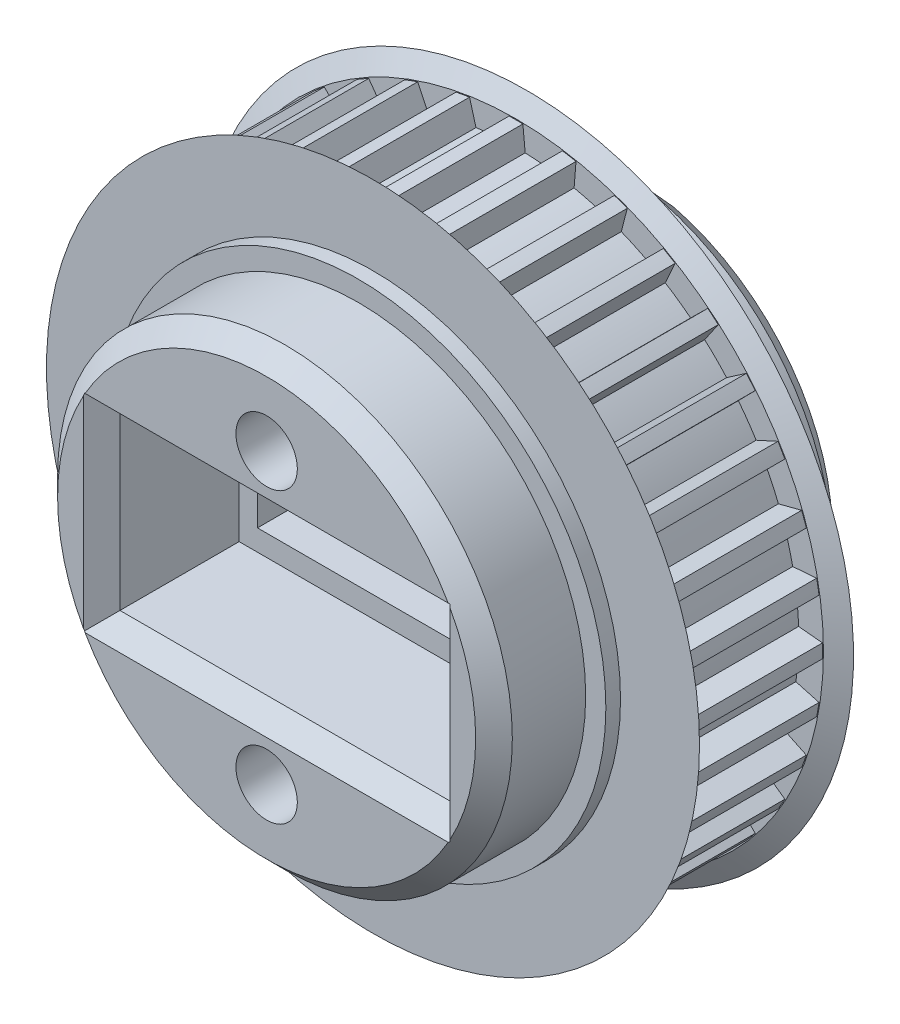
from build123d import *
from build123d.topology import SkipClean

# Parameters (mm, degrees)
CROQUIS1_R                 = 2
SALIENTE_EXTRUIR1_DEPTH    = 7.2
CROQUIS2_R                 = 18.5
CROQUIS2_R_2               = 2
SALIENTE_EXTRUIR2_DEPTH    = 0.6
SALIENTE_EXTRUIR4_START    = 5.8
CROQUIS4_R                 = 12.45
CROQUIS4_R_2               = 2
SALIENTE_EXTRUIR4_DEPTH    = 5.8
SALIENTE_EXTRUIR6_START    = 0.6
CROQUIS6_R                 = 18.5
CROQUIS6_R_2               = 2
SALIENTE_EXTRUIR6_DEPTH    = 0.6
SALIENTE_EXTRUIR5_START    = 0.6
CROQUIS5_R                 = 13.5
CROQUIS5_R_2               = 2
SALIENTE_EXTRUIR5_DEPTH    = 0.6
CHAFL_N2_SIZE              = 1.732050808
CHAFL_N2_SIZE_2            = 1
CROQUIS3_R                 = 12.4
CROQUIS3_R_2               = 2
SALIENTE_EXTRUIR7_DEPTH    = 5.8
CHAFL_N4_SIZE              = 1
CROQUIS7_R                 = 13.5
CROQUIS7_R_2               = 2
SALIENTE_EXTRUIR8_DEPTH    = 0.8
CORTAR_EXTRUIR1_DEPTH      = 29.620819277
CORTAR_EXTRUIR1_DEPTH_BACK = 29.620819277
CROQUIS8_R                 = 1.675
CROQUIS8_W                 = 16
CROQUIS8_H                 = 7
CORTAR_EXTRUIR2_DEPTH      = 5.5
REDONDEO1_R                = 2.5
CROQUIS10_W                = 18
CROQUIS10_H                = 9.3
CORTAR_EXTRUIR3_DEPTH      = 7.5
CHAFL_N5_SIZE              = 1


with BuildPart() as part:
    # Croquis1 → Saliente-Extruir1 (new body)
    with BuildSketch(Plane.XY):
        with BuildLine():
            Line((-0.375, 16.714216942), (-0.5, 15.410313844))
            ThreePointArc((-0.5, 15.410313844), (-1.343804123, 15.359751406), (-2.18356904, 15.263020639))
            Line((-2.18356904, 15.263020639), (-2.533090406, 16.525408497))
            ThreePointArc((-2.533090406, 16.525408497), (-2.903123715, 16.464432747), (-3.271696221, 16.395172363))
            Line((-3.271696221, 16.395172363), (-3.168376793, 15.089372461))
            ThreePointArc((-3.168376793, 15.089372461), (-3.99058156, 14.893053132), (-4.800791439, 14.651968275))
            Line((-4.800791439, 14.651968275), (-5.364214141, 15.834483876))
            ThreePointArc((-5.364214141, 15.834483876), (-5.718037486, 15.710178876), (-6.068983607, 15.577968769))
            Line((-6.068983607, 15.577968769), (-5.74048406, 14.309948132))
            ThreePointArc((-5.74048406, 14.309948132), (-6.516107195, 13.973836975), (-7.27214422, 13.595723269))
            Line((-7.27214422, 13.595723269), (-8.032348945, 14.662436476))
            ThreePointArc((-8.032348945, 14.662436476), (-8.35921158, 14.478579169), (-8.681867997, 14.287436476))
            Line((-8.681867997, 14.287436476), (-8.138169624, 13.095723269))
            ThreePointArc((-8.138169624, 13.095723269), (-8.843644211, 12.630032852), (-9.522536579, 12.126379092))
            Line((-9.522536579, 12.126379092), (-10.45642489, 13.044878363))
            ThreePointArc((-10.45642489, 13.044878363), (-10.746395261, 12.80705516), (-11.030958222, 12.562787656))
            Line((-11.030958222, 12.562787656), (-10.288581022, 11.483591482))
            ThreePointArc((-10.288581022, 11.483591482), (-10.902471572, 10.902471572), (-11.483591482, 10.288581022))
            Line((-11.483591482, 10.288581022), (-12.562787656, 11.030958222))
            ThreePointArc((-12.562787656, 11.030958222), (-12.80705516, 10.746395261), (-13.044878363, 10.45642489))
            Line((-13.044878363, 10.45642489), (-12.126379092, 9.522536579))
            ThreePointArc((-12.126379092, 9.522536579), (-12.630032852, 8.843644211), (-13.095723269, 8.138169624))
            Line((-13.095723269, 8.138169624), (-14.287436476, 8.681867997))
            ThreePointArc((-14.287436476, 8.681867997), (-14.478579169, 8.35921158), (-14.662436476, 8.032348945))
            Line((-14.662436476, 8.032348945), (-13.595723269, 7.27214422))
            ThreePointArc((-13.595723269, 7.27214422), (-13.973836975, 6.516107195), (-14.309948132, 5.74048406))
            Line((-14.309948132, 5.74048406), (-15.577968769, 6.068983607))
            ThreePointArc((-15.577968769, 6.068983607), (-15.710178876, 5.718037486), (-15.834483876, 5.364214141))
            Line((-15.834483876, 5.364214141), (-14.651968275, 4.800791439))
            ThreePointArc((-14.651968275, 4.800791439), (-14.893053132, 3.99058156), (-15.089372461, 3.168376793))
            Line((-15.089372461, 3.168376793), (-16.395172363, 3.271696221))
            ThreePointArc((-16.395172363, 3.271696221), (-16.464432747, 2.903123715), (-16.525408497, 2.533090406))
            Line((-16.525408497, 2.533090406), (-15.263020639, 2.18356904))
            ThreePointArc((-15.263020639, 2.18356904), (-15.359751406, 1.343804123), (-15.410313844, 0.5))
            Line((-15.410313844, 0.5), (-16.714216942, 0.375))
            ThreePointArc((-16.714216942, 0.375), (-16.718423161, 0), (-16.714216942, -0.375))
            Line((-16.714216942, -0.375), (-15.410313844, -0.5))
            ThreePointArc((-15.410313844, -0.5), (-15.359751406, -1.343804123), (-15.263020639, -2.18356904))
            Line((-15.263020639, -2.18356904), (-16.525408497, -2.533090406))
            ThreePointArc((-16.525408497, -2.533090406), (-16.464432747, -2.903123715), (-16.395172363, -3.271696221))
            Line((-16.395172363, -3.271696221), (-15.089372461, -3.168376793))
            ThreePointArc((-15.089372461, -3.168376793), (-14.893053132, -3.99058156), (-14.651968275, -4.800791439))
            Line((-14.651968275, -4.800791439), (-15.834483876, -5.364214141))
            ThreePointArc((-15.834483876, -5.364214141), (-15.710178876, -5.718037486), (-15.577968769, -6.068983607))
            Line((-15.577968769, -6.068983607), (-14.309948132, -5.74048406))
            ThreePointArc((-14.309948132, -5.74048406), (-13.973836975, -6.516107195), (-13.595723269, -7.27214422))
            Line((-13.595723269, -7.27214422), (-14.662436476, -8.032348945))
            ThreePointArc((-14.662436476, -8.032348945), (-14.478579169, -8.35921158), (-14.287436476, -8.681867997))
            Line((-14.287436476, -8.681867997), (-13.095723269, -8.138169624))
            ThreePointArc((-13.095723269, -8.138169624), (-12.630032852, -8.843644211), (-12.126379092, -9.522536579))
            Line((-12.126379092, -9.522536579), (-13.044878363, -10.45642489))
            ThreePointArc((-13.044878363, -10.45642489), (-12.80705516, -10.746395261), (-12.562787656, -11.030958222))
            Line((-12.562787656, -11.030958222), (-11.483591482, -10.288581022))
            ThreePointArc((-11.483591482, -10.288581022), (-10.902471572, -10.902471572), (-10.288581022, -11.483591482))
            Line((-10.288581022, -11.483591482), (-11.030958222, -12.562787656))
            ThreePointArc((-11.030958222, -12.562787656), (-10.746395261, -12.80705516), (-10.45642489, -13.044878363))
            Line((-10.45642489, -13.044878363), (-9.522536579, -12.126379092))
            ThreePointArc((-9.522536579, -12.126379092), (-8.843644211, -12.630032852), (-8.138169624, -13.095723269))
            Line((-8.138169624, -13.095723269), (-8.681867997, -14.287436476))
            ThreePointArc((-8.681867997, -14.287436476), (-8.35921158, -14.478579169), (-8.032348945, -14.662436476))
            Line((-8.032348945, -14.662436476), (-7.27214422, -13.595723269))
            ThreePointArc((-7.27214422, -13.595723269), (-6.516107195, -13.973836975), (-5.74048406, -14.309948132))
            Line((-5.74048406, -14.309948132), (-6.068983607, -15.577968769))
            ThreePointArc((-6.068983607, -15.577968769), (-5.718037486, -15.710178876), (-5.364214141, -15.834483876))
            Line((-5.364214141, -15.834483876), (-4.800791439, -14.651968275))
            ThreePointArc((-4.800791439, -14.651968275), (-3.99058156, -14.893053132), (-3.168376793, -15.089372461))
            Line((-3.168376793, -15.089372461), (-3.271696221, -16.395172363))
            ThreePointArc((-3.271696221, -16.395172363), (-2.903123715, -16.464432747), (-2.533090406, -16.525408497))
            Line((-2.533090406, -16.525408497), (-2.18356904, -15.263020639))
            ThreePointArc((-2.18356904, -15.263020639), (-1.343804123, -15.359751406), (-0.5, -15.410313844))
            Line((-0.5, -15.410313844), (-0.375, -16.714216942))
            ThreePointArc((-0.375, -16.714216942), (0, -16.718423161), (0.375, -16.714216942))
            Line((0.375, -16.714216942), (0.5, -15.410313844))
            ThreePointArc((0.5, -15.410313844), (1.343804123, -15.359751406), (2.18356904, -15.263020639))
            Line((2.18356904, -15.263020639), (2.533090406, -16.525408497))
            ThreePointArc((2.533090406, -16.525408497), (2.903123715, -16.464432747), (3.271696221, -16.395172363))
            Line((3.271696221, -16.395172363), (3.168376793, -15.089372461))
            ThreePointArc((3.168376793, -15.089372461), (3.99058156, -14.893053132), (4.800791439, -14.651968275))
            Line((4.800791439, -14.651968275), (5.364214141, -15.834483876))
            ThreePointArc((5.364214141, -15.834483876), (5.718037486, -15.710178876), (6.068983607, -15.577968769))
            Line((6.068983607, -15.577968769), (5.74048406, -14.309948132))
            ThreePointArc((5.74048406, -14.309948132), (6.516107195, -13.973836975), (7.27214422, -13.595723269))
            Line((7.27214422, -13.595723269), (8.032348945, -14.662436476))
            ThreePointArc((8.032348945, -14.662436476), (8.35921158, -14.478579169), (8.681867997, -14.287436476))
            Line((8.681867997, -14.287436476), (8.138169624, -13.095723269))
            ThreePointArc((8.138169624, -13.095723269), (8.843644211, -12.630032852), (9.522536579, -12.126379092))
            Line((9.522536579, -12.126379092), (10.45642489, -13.044878363))
            ThreePointArc((10.45642489, -13.044878363), (10.746395261, -12.80705516), (11.030958222, -12.562787656))
            Line((11.030958222, -12.562787656), (10.288581022, -11.483591482))
            ThreePointArc((10.288581022, -11.483591482), (10.902471572, -10.902471572), (11.483591482, -10.288581022))
            Line((11.483591482, -10.288581022), (12.562787656, -11.030958222))
            ThreePointArc((12.562787656, -11.030958222), (12.80705516, -10.746395261), (13.044878363, -10.45642489))
            Line((13.044878363, -10.45642489), (12.126379092, -9.522536579))
            ThreePointArc((12.126379092, -9.522536579), (12.630032852, -8.843644211), (13.095723269, -8.138169624))
            Line((13.095723269, -8.138169624), (14.287436476, -8.681867997))
            ThreePointArc((14.287436476, -8.681867997), (14.478579169, -8.35921158), (14.662436476, -8.032348945))
            Line((14.662436476, -8.032348945), (13.595723269, -7.27214422))
            ThreePointArc((13.595723269, -7.27214422), (13.973836975, -6.516107195), (14.309948132, -5.74048406))
            Line((14.309948132, -5.74048406), (15.577968769, -6.068983607))
            ThreePointArc((15.577968769, -6.068983607), (15.710178876, -5.718037486), (15.834483876, -5.364214141))
            Line((15.834483876, -5.364214141), (14.651968275, -4.800791439))
            ThreePointArc((14.651968275, -4.800791439), (14.893053132, -3.99058156), (15.089372461, -3.168376793))
            Line((15.089372461, -3.168376793), (16.395172363, -3.271696221))
            ThreePointArc((16.395172363, -3.271696221), (16.464432747, -2.903123715), (16.525408497, -2.533090406))
            Line((16.525408497, -2.533090406), (15.263020639, -2.18356904))
            ThreePointArc((15.263020639, -2.18356904), (15.359751406, -1.343804123), (15.410313844, -0.5))
            Line((15.410313844, -0.5), (16.714216942, -0.375))
            ThreePointArc((16.714216942, -0.375), (16.718423161, 0), (16.714216942, 0.375))
            Line((16.714216942, 0.375), (15.410313844, 0.5))
            ThreePointArc((15.410313844, 0.5), (15.359751406, 1.343804123), (15.263020639, 2.18356904))
            Line((15.263020639, 2.18356904), (16.525408497, 2.533090406))
            ThreePointArc((16.525408497, 2.533090406), (16.464432747, 2.903123715), (16.395172363, 3.271696221))
            Line((16.395172363, 3.271696221), (15.089372461, 3.168376793))
            ThreePointArc((15.089372461, 3.168376793), (14.893053132, 3.99058156), (14.651968275, 4.800791439))
            Line((14.651968275, 4.800791439), (15.834483876, 5.364214141))
            ThreePointArc((15.834483876, 5.364214141), (15.710178876, 5.718037486), (15.577968769, 6.068983607))
            Line((15.577968769, 6.068983607), (14.309948132, 5.74048406))
            ThreePointArc((14.309948132, 5.74048406), (13.973836975, 6.516107195), (13.595723269, 7.27214422))
            Line((13.595723269, 7.27214422), (14.662436476, 8.032348945))
            ThreePointArc((14.662436476, 8.032348945), (14.478579169, 8.35921158), (14.287436476, 8.681867997))
            Line((14.287436476, 8.681867997), (13.095723269, 8.138169624))
            ThreePointArc((13.095723269, 8.138169624), (12.630032852, 8.843644211), (12.126379092, 9.522536579))
            Line((12.126379092, 9.522536579), (13.044878363, 10.45642489))
            ThreePointArc((13.044878363, 10.45642489), (12.80705516, 10.746395261), (12.562787656, 11.030958222))
            Line((12.562787656, 11.030958222), (11.483591482, 10.288581022))
            ThreePointArc((11.483591482, 10.288581022), (10.902471572, 10.902471572), (10.288581022, 11.483591482))
            Line((10.288581022, 11.483591482), (11.030958222, 12.562787656))
            ThreePointArc((11.030958222, 12.562787656), (10.746395261, 12.80705516), (10.45642489, 13.044878363))
            Line((10.45642489, 13.044878363), (9.522536579, 12.126379092))
            ThreePointArc((9.522536579, 12.126379092), (8.843644211, 12.630032852), (8.138169624, 13.095723269))
            Line((8.138169624, 13.095723269), (8.681867997, 14.287436476))
            ThreePointArc((8.681867997, 14.287436476), (8.35921158, 14.478579169), (8.032348945, 14.662436476))
            Line((8.032348945, 14.662436476), (7.27214422, 13.595723269))
            ThreePointArc((7.27214422, 13.595723269), (6.516107195, 13.973836975), (5.74048406, 14.309948132))
            Line((5.74048406, 14.309948132), (6.068983607, 15.577968769))
            ThreePointArc((6.068983607, 15.577968769), (5.718037486, 15.710178876), (5.364214141, 15.834483876))
            Line((5.364214141, 15.834483876), (4.800791439, 14.651968275))
            ThreePointArc((4.800791439, 14.651968275), (3.99058156, 14.893053132), (3.168376793, 15.089372461))
            Line((3.168376793, 15.089372461), (3.271696221, 16.395172363))
            ThreePointArc((3.271696221, 16.395172363), (2.903123715, 16.464432747), (2.533090406, 16.525408497))
            Line((2.533090406, 16.525408497), (2.18356904, 15.263020639))
            ThreePointArc((2.18356904, 15.263020639), (1.343804123, 15.359751406), (0.5, 15.410313844))
            Line((0.5, 15.410313844), (0.375, 16.714216942))
            ThreePointArc((0.375, 16.714216942), (0, 16.718423161), (-0.375, 16.714216942))
        make_face()
        Circle(CROQUIS1_R, mode=Mode.SUBTRACT)
    extrude(amount=SALIENTE_EXTRUIR1_DEPTH)

    # Croquis2 → Saliente-Extruir2 (add)
    with BuildSketch(Plane.XY.offset(7.2)):
        Circle(CROQUIS2_R)
        Circle(CROQUIS2_R_2, mode=Mode.SUBTRACT)
    extrude(amount=SALIENTE_EXTRUIR2_DEPTH)

    # Croquis4 → Saliente-Extruir4 (add)
    with BuildSketch(Plane(origin=(0, 0, 0), x_dir=(-1, 0, 0), z_dir=(0, 0, -1)).offset(SALIENTE_EXTRUIR4_START)):
        with Locations(Location((0, 0, 0), (0, 0, 180))):
            Circle(CROQUIS4_R)
        Circle(CROQUIS4_R_2, mode=Mode.SUBTRACT)
    extrude(amount=-SALIENTE_EXTRUIR4_DEPTH)

    # Croquis6 → Saliente-Extruir6 (add)
    with SkipClean():  # the faces are left unmerged after this step: merging them gives an invalid solid
        with BuildSketch(Plane(origin=(0, 0, 0), x_dir=(-1, 0, 0), z_dir=(0, 0, -1)).offset(SALIENTE_EXTRUIR6_START)):
            with Locations(Location((0, 0, 0), (0, 0, 180))):
                Circle(CROQUIS6_R)
            Circle(CROQUIS6_R_2, mode=Mode.SUBTRACT)
        extrude(amount=-SALIENTE_EXTRUIR6_DEPTH)

    # Croquis5 → Saliente-Extruir5 (add)
    with SkipClean():  # the faces are left unmerged after this step: merging them gives an invalid solid
        with BuildSketch(Plane(origin=(0, 0, -0.6), x_dir=(-1, 0, 0), z_dir=(0, 0, -1)).offset(SALIENTE_EXTRUIR5_START)):
            Circle(CROQUIS5_R)
            Circle(CROQUIS5_R_2, mode=Mode.SUBTRACT)
        extrude(amount=-SALIENTE_EXTRUIR5_DEPTH)

    # Chaflán2
    # the kernel refuses this chamfer: 1.732050808, 1 mm, written as the material it takes off along each edge
    with BuildSketch(Plane(origin=(0, 0, 0), x_dir=(1, 0, 0), z_dir=(0, 1, 0))) as chafl_n2_piece_1:
        Polygon((18.5 - CHAFL_N2_SIZE, 0), (18.5, CHAFL_N2_SIZE_2), (18.5, 0), align=None)
    revolve(axis=Axis((0, 0, 0), (0, 0, -1)), mode=Mode.SUBTRACT)
    with BuildSketch(Plane(origin=(0, 0, 7.2), x_dir=(1, 0, 0), z_dir=(0, -1, 0))) as chafl_n2_piece_2:
        Polygon((18.5 - CHAFL_N2_SIZE, 0), (18.5, CHAFL_N2_SIZE_2), (18.5, 0), align=None)
    revolve(axis=Axis((0, 0, 7.2), (0, 0, 1)), mode=Mode.SUBTRACT)

    # Croquis3 → Saliente-Extruir7 (add)
    with BuildSketch(Plane.XY.offset(7.8)):
        Circle(CROQUIS3_R)
        with Locations(Location((0, 0, 0), (0, 0, 180))):
            Circle(CROQUIS3_R_2, mode=Mode.SUBTRACT)
    extrude(amount=SALIENTE_EXTRUIR7_DEPTH)

    # Chaflán4
    chafl_n4_edges = [part.edges().sort_by_distance(p)[0] for p in [
        (-12.45, 0, -5.8),
        (-12.4, 0, 13.6),
    ]]
    chamfer(chafl_n4_edges, length=CHAFL_N4_SIZE)

    # Croquis7 → Saliente-Extruir8 (add)
    with BuildSketch(Plane.XY.offset(7.8)):
        with Locations(Location((0, 0, 0), (0, 0, 180))):
            Circle(CROQUIS7_R)
        with Locations(Location((0, 0, 0), (0, 0, 180))):
            Circle(CROQUIS7_R_2, mode=Mode.SUBTRACT)
    extrude(amount=SALIENTE_EXTRUIR8_DEPTH)

    # Croquis8 → Cortar-Extruir1 (cut, two sides: drawn at the far end of the back side and taken through both)
    with BuildSketch(Plane.XY.offset(-CORTAR_EXTRUIR1_DEPTH_BACK)):
        with Locations((0, 7.875631857)):
            Circle(CROQUIS8_R)
        with Locations((0, -7.875631857)):
            Circle(CROQUIS8_R)
        Rectangle(CROQUIS8_W, CROQUIS8_H)
    extrude(amount=CORTAR_EXTRUIR1_DEPTH + CORTAR_EXTRUIR1_DEPTH_BACK, mode=Mode.SUBTRACT)

    # Croquis9 → Cortar-Extruir2 (cut)
    with BuildSketch(Plane(origin=(0, 0, -5.8), x_dir=(-1, 0, 0), z_dir=(0, 0, -1))):
        Polygon((2.33826859, 3.825631857), (4.67653718, 7.875631857), (2.33826859, 11.925631857), (-2.33826859, 11.925631857), (-4.67653718, 7.875631857), (-2.33826859, 3.825631857), align=None)
        Polygon((2.33826859, -11.925631857), (4.67653718, -7.875631857), (2.33826859, -3.825631857), (-2.33826859, -3.825631857), (-4.67653718, -7.875631857), (-2.33826859, -11.925631857), align=None)
    extrude(amount=-CORTAR_EXTRUIR2_DEPTH, mode=Mode.SUBTRACT)

    # Redondeo1
    redondeo1_edges = [part.edges().sort_by_distance(p)[0] for p in [
        (0, 3.825631857, -0.3),
        (3.507402885, 5.850631857, -0.3),
        (3.507402885, 9.900631857, -0.3),
        (0, 11.925631857, -0.3),
        (-3.507402885, 9.900631857, -0.3),
        (-3.507402885, 5.850631857, -0.3),
        (0, -11.925631857, -0.3),
        (3.507402885, -9.900631857, -0.3),
        (3.507402885, -5.850631857, -0.3),
        (0, -3.825631857, -0.3),
        (-3.507402885, -5.850631857, -0.3),
        (-3.507402885, -9.900631857, -0.3),
    ]]
    fillet(redondeo1_edges, radius=REDONDEO1_R)

    # Croquis10 → Cortar-Extruir3 (cut)
    with BuildSketch(Plane.XY.offset(13.6)):
        Rectangle(CROQUIS10_W, CROQUIS10_H)
    extrude(amount=-CORTAR_EXTRUIR3_DEPTH, mode=Mode.SUBTRACT)

    # Chaflán5
    # the kernel refuses this chamfer: 1 mm, written as the material it takes off along each edge
    with BuildSketch(Plane(origin=(-8, -3.5, -5.8), x_dir=(-0.9996219169112968, 0, -0.02749587661058651), z_dir=(0, 1, 0)), Plane(origin=(8, 3.5, -5.8), x_dir=(0.9996219169112968, 0, -0.02749587661058651), z_dir=(0, -1, 0))) as chafl_n5_piece_1:
        Polygon((CHAFL_N5_SIZE * 0.999621916911, CHAFL_N5_SIZE * 0.0274958766106), (-CHAFL_N5_SIZE * 0.0274958766106, CHAFL_N5_SIZE * 0.999621916911), (0, 0), align=None)
    extrude(amount=7, mode=Mode.SUBTRACT)
    with BuildSketch(Plane(origin=(-8, 3.5, -5.8), x_dir=(0, 0.9996219169112968, -0.027495876610586487), z_dir=(1, 0, 0)), Plane(origin=(8, -3.5, -5.8), x_dir=(0, -0.9996219169112968, -0.027495876610586497), z_dir=(-1, 0, 0))) as chafl_n5_piece_2:
        Polygon((CHAFL_N5_SIZE * 0.999621916911, CHAFL_N5_SIZE * 0.0274958766106), (-CHAFL_N5_SIZE * 0.0274958766106, CHAFL_N5_SIZE * 0.999621916911), (0, 0), align=None)
    extrude(amount=16, mode=Mode.SUBTRACT)
    with BuildSketch(Plane(origin=(9, -4.65, 13.6), x_dir=(0.9996219169112968, 0, 0.027495876610585647), z_dir=(0, 1, 0)), Plane(origin=(-9, 4.65, 13.6), x_dir=(-0.9996219169112968, 0, 0.027495876610585647), z_dir=(0, -1, 0))) as chafl_n5_piece_3:
        Polygon((CHAFL_N5_SIZE * 0.999621916911, CHAFL_N5_SIZE * 0.0274958766106), (-CHAFL_N5_SIZE * 0.0274958766106, CHAFL_N5_SIZE * 0.999621916911), (0, 0), align=None)
    extrude(amount=9.3, mode=Mode.SUBTRACT)
    with BuildSketch(Plane(origin=(9, 4.65, 13.6), x_dir=(0, 0.9996219169112968, 0.027495876610585623), z_dir=(-1, 0, 0)), Plane(origin=(-9, -4.65, 13.6), x_dir=(0, -0.9996219169112968, 0.027495876610585623), z_dir=(1, 0, 0))) as chafl_n5_piece_4:
        Polygon((CHAFL_N5_SIZE * 0.999621916911, CHAFL_N5_SIZE * 0.0274958766106), (-CHAFL_N5_SIZE * 0.0274958766106, CHAFL_N5_SIZE * 0.999621916911), (0, 0), align=None)
    extrude(amount=18, mode=Mode.SUBTRACT)
    with BuildSketch(Plane(origin=(-8, -6.071682988, -5.8), x_dir=(-0.9996219169112968, 0, -0.02749587661058651), z_dir=(0, 1, 0))) as chafl_n5_piece_5a_section:
        Polygon((CHAFL_N5_SIZE * 0.999621916911, CHAFL_N5_SIZE * 0.0274958766106), (-CHAFL_N5_SIZE * 0.0274958766106, CHAFL_N5_SIZE * 0.999621916911), (0, 0), align=None)
    chafl_n5_piece_5a = extrude(amount=9.571682988, mode=Mode.PRIVATE)
    chafl_n5_piece_5a = split(chafl_n5_piece_5a, bisect_by=Plane(origin=(-8.329793627, -3.5, -5.470206373), z_dir=(0, -1, 0)), keep=Keep.TOP, mode=Mode.PRIVATE)
    with BuildSketch(Plane(origin=(8, -3.5, -5.8), x_dir=(0, -0.9996219169112968, -0.027495876610586497), z_dir=(-1, 0, 0))) as chafl_n5_piece_5b_section:
        Polygon((CHAFL_N5_SIZE * 0.999621916911, CHAFL_N5_SIZE * 0.0274958766106), (-CHAFL_N5_SIZE * 0.0274958766106, CHAFL_N5_SIZE * 0.999621916911), (0, 0), align=None)
    chafl_n5_piece_5b = extrude(amount=18.571682988, mode=Mode.PRIVATE)
    chafl_n5_piece_5b = split(chafl_n5_piece_5b, bisect_by=Plane(origin=(-8, -3.829793627, -5.470206373), z_dir=(-1, 0, 0)), keep=Keep.TOP, mode=Mode.PRIVATE)
    chafl_n5_piece_5 = chafl_n5_piece_5a & chafl_n5_piece_5b
    add(chafl_n5_piece_5, mode=Mode.SUBTRACT)
    with BuildSketch(Plane(origin=(-10.571682988, 3.5, -5.8), x_dir=(0, 0.9996219169112968, -0.027495876610586487), z_dir=(1, 0, 0))) as chafl_n5_piece_6a_section:
        Polygon((CHAFL_N5_SIZE * 0.999621916911, CHAFL_N5_SIZE * 0.0274958766106), (-CHAFL_N5_SIZE * 0.0274958766106, CHAFL_N5_SIZE * 0.999621916911), (0, 0), align=None)
    chafl_n5_piece_6a = extrude(amount=18.571682988, mode=Mode.PRIVATE)
    chafl_n5_piece_6a = split(chafl_n5_piece_6a, bisect_by=Plane(origin=(-8, 3.829793627, -5.470206373), z_dir=(-1, 0, 0)), keep=Keep.TOP, mode=Mode.PRIVATE)
    with BuildSketch(Plane(origin=(-8, -3.5, -5.8), x_dir=(-0.9996219169112968, 0, -0.02749587661058651), z_dir=(0, 1, 0))) as chafl_n5_piece_6b_section:
        Polygon((CHAFL_N5_SIZE * 0.999621916911, CHAFL_N5_SIZE * 0.0274958766106), (-CHAFL_N5_SIZE * 0.0274958766106, CHAFL_N5_SIZE * 0.999621916911), (0, 0), align=None)
    chafl_n5_piece_6b = extrude(amount=9.571682988, mode=Mode.PRIVATE)
    chafl_n5_piece_6b = split(chafl_n5_piece_6b, bisect_by=Plane(origin=(-8.329793627, 3.5, -5.470206373), z_dir=(0, 1, 0)), keep=Keep.TOP, mode=Mode.PRIVATE)
    chafl_n5_piece_6 = chafl_n5_piece_6a & chafl_n5_piece_6b
    add(chafl_n5_piece_6, mode=Mode.SUBTRACT)
    with BuildSketch(Plane(origin=(-8, 3.5, -5.8), x_dir=(0, 0.9996219169112968, -0.027495876610586487), z_dir=(1, 0, 0))) as chafl_n5_piece_7a_section:
        Polygon((CHAFL_N5_SIZE * 0.999621916911, CHAFL_N5_SIZE * 0.0274958766106), (-CHAFL_N5_SIZE * 0.0274958766106, CHAFL_N5_SIZE * 0.999621916911), (0, 0), align=None)
    chafl_n5_piece_7a = extrude(amount=18.571682988, mode=Mode.PRIVATE)
    chafl_n5_piece_7a = split(chafl_n5_piece_7a, bisect_by=Plane(origin=(8, 3.829793627, -5.470206373), z_dir=(1, 0, 0)), keep=Keep.TOP, mode=Mode.PRIVATE)
    with BuildSketch(Plane(origin=(8, 6.071682988, -5.8), x_dir=(0.9996219169112968, 0, -0.02749587661058651), z_dir=(0, -1, 0))) as chafl_n5_piece_7b_section:
        Polygon((CHAFL_N5_SIZE * 0.999621916911, CHAFL_N5_SIZE * 0.0274958766106), (-CHAFL_N5_SIZE * 0.0274958766106, CHAFL_N5_SIZE * 0.999621916911), (0, 0), align=None)
    chafl_n5_piece_7b = extrude(amount=9.571682988, mode=Mode.PRIVATE)
    chafl_n5_piece_7b = split(chafl_n5_piece_7b, bisect_by=Plane(origin=(8.329793627, 3.5, -5.470206373), z_dir=(0, 1, 0)), keep=Keep.TOP, mode=Mode.PRIVATE)
    chafl_n5_piece_7 = chafl_n5_piece_7a & chafl_n5_piece_7b
    add(chafl_n5_piece_7, mode=Mode.SUBTRACT)
    with BuildSketch(Plane(origin=(8, 3.5, -5.8), x_dir=(0.9996219169112968, 0, -0.02749587661058651), z_dir=(0, -1, 0))) as chafl_n5_piece_8a_section:
        Polygon((CHAFL_N5_SIZE * 0.999621916911, CHAFL_N5_SIZE * 0.0274958766106), (-CHAFL_N5_SIZE * 0.0274958766106, CHAFL_N5_SIZE * 0.999621916911), (0, 0), align=None)
    chafl_n5_piece_8a = extrude(amount=9.571682988, mode=Mode.PRIVATE)
    chafl_n5_piece_8a = split(chafl_n5_piece_8a, bisect_by=Plane(origin=(8.329793627, -3.5, -5.470206373), z_dir=(0, -1, 0)), keep=Keep.TOP, mode=Mode.PRIVATE)
    with BuildSketch(Plane(origin=(10.571682988, -3.5, -5.8), x_dir=(0, -0.9996219169112968, -0.027495876610586497), z_dir=(-1, 0, 0))) as chafl_n5_piece_8b_section:
        Polygon((CHAFL_N5_SIZE * 0.999621916911, CHAFL_N5_SIZE * 0.0274958766106), (-CHAFL_N5_SIZE * 0.0274958766106, CHAFL_N5_SIZE * 0.999621916911), (0, 0), align=None)
    chafl_n5_piece_8b = extrude(amount=18.571682988, mode=Mode.PRIVATE)
    chafl_n5_piece_8b = split(chafl_n5_piece_8b, bisect_by=Plane(origin=(8, -3.829793627, -5.470206373), z_dir=(1, 0, 0)), keep=Keep.TOP, mode=Mode.PRIVATE)
    chafl_n5_piece_8 = chafl_n5_piece_8a & chafl_n5_piece_8b
    add(chafl_n5_piece_8, mode=Mode.SUBTRACT)
    with BuildSketch(Plane(origin=(-9, -4.65, 13.6), x_dir=(0, -0.9996219169112968, 0.027495876610585623), z_dir=(1, 0, 0))) as chafl_n5_piece_9a_section:
        Polygon((CHAFL_N5_SIZE * 0.999621916911, CHAFL_N5_SIZE * 0.0274958766106), (-CHAFL_N5_SIZE * 0.0274958766106, CHAFL_N5_SIZE * 0.999621916911), (0, 0), align=None)
    chafl_n5_piece_9a = extrude(amount=20.571682988, mode=Mode.PRIVATE)
    chafl_n5_piece_9a = split(chafl_n5_piece_9a, bisect_by=Plane(origin=(9, -4.979793627, 13.270206373), z_dir=(1, 0, 0)), keep=Keep.TOP, mode=Mode.PRIVATE)
    with BuildSketch(Plane(origin=(9, -7.221682988, 13.6), x_dir=(0.9996219169112968, 0, 0.027495876610585647), z_dir=(0, 1, 0))) as chafl_n5_piece_9b_section:
        Polygon((CHAFL_N5_SIZE * 0.999621916911, CHAFL_N5_SIZE * 0.0274958766106), (-CHAFL_N5_SIZE * 0.0274958766106, CHAFL_N5_SIZE * 0.999621916911), (0, 0), align=None)
    chafl_n5_piece_9b = extrude(amount=11.871682988, mode=Mode.PRIVATE)
    chafl_n5_piece_9b = split(chafl_n5_piece_9b, bisect_by=Plane(origin=(9.329793627, -4.65, 13.270206373), z_dir=(0, -1, 0)), keep=Keep.TOP, mode=Mode.PRIVATE)
    chafl_n5_piece_9 = chafl_n5_piece_9a & chafl_n5_piece_9b
    add(chafl_n5_piece_9, mode=Mode.SUBTRACT)
    with BuildSketch(Plane(origin=(11.571682988, 4.65, 13.6), x_dir=(0, 0.9996219169112968, 0.027495876610585623), z_dir=(-1, 0, 0))) as chafl_n5_piece_10a_section:
        Polygon((CHAFL_N5_SIZE * 0.999621916911, CHAFL_N5_SIZE * 0.0274958766106), (-CHAFL_N5_SIZE * 0.0274958766106, CHAFL_N5_SIZE * 0.999621916911), (0, 0), align=None)
    chafl_n5_piece_10a = extrude(amount=20.571682988, mode=Mode.PRIVATE)
    chafl_n5_piece_10a = split(chafl_n5_piece_10a, bisect_by=Plane(origin=(9, 4.979793627, 13.270206373), z_dir=(1, 0, 0)), keep=Keep.TOP, mode=Mode.PRIVATE)
    with BuildSketch(Plane(origin=(9, -4.65, 13.6), x_dir=(0.9996219169112968, 0, 0.027495876610585647), z_dir=(0, 1, 0))) as chafl_n5_piece_10b_section:
        Polygon((CHAFL_N5_SIZE * 0.999621916911, CHAFL_N5_SIZE * 0.0274958766106), (-CHAFL_N5_SIZE * 0.0274958766106, CHAFL_N5_SIZE * 0.999621916911), (0, 0), align=None)
    chafl_n5_piece_10b = extrude(amount=11.871682988, mode=Mode.PRIVATE)
    chafl_n5_piece_10b = split(chafl_n5_piece_10b, bisect_by=Plane(origin=(9.329793627, 4.65, 13.270206373), z_dir=(0, 1, 0)), keep=Keep.TOP, mode=Mode.PRIVATE)
    chafl_n5_piece_10 = chafl_n5_piece_10a & chafl_n5_piece_10b
    add(chafl_n5_piece_10, mode=Mode.SUBTRACT)
    with BuildSketch(Plane(origin=(9, 4.65, 13.6), x_dir=(0, 0.9996219169112968, 0.027495876610585623), z_dir=(-1, 0, 0))) as chafl_n5_piece_11a_section:
        Polygon((CHAFL_N5_SIZE * 0.999621916911, CHAFL_N5_SIZE * 0.0274958766106), (-CHAFL_N5_SIZE * 0.0274958766106, CHAFL_N5_SIZE * 0.999621916911), (0, 0), align=None)
    chafl_n5_piece_11a = extrude(amount=20.571682988, mode=Mode.PRIVATE)
    chafl_n5_piece_11a = split(chafl_n5_piece_11a, bisect_by=Plane(origin=(-9, 4.979793627, 13.270206373), z_dir=(-1, 0, 0)), keep=Keep.TOP, mode=Mode.PRIVATE)
    with BuildSketch(Plane(origin=(-9, 7.221682988, 13.6), x_dir=(-0.9996219169112968, 0, 0.027495876610585647), z_dir=(0, -1, 0))) as chafl_n5_piece_11b_section:
        Polygon((CHAFL_N5_SIZE * 0.999621916911, CHAFL_N5_SIZE * 0.0274958766106), (-CHAFL_N5_SIZE * 0.0274958766106, CHAFL_N5_SIZE * 0.999621916911), (0, 0), align=None)
    chafl_n5_piece_11b = extrude(amount=11.871682988, mode=Mode.PRIVATE)
    chafl_n5_piece_11b = split(chafl_n5_piece_11b, bisect_by=Plane(origin=(-9.329793627, 4.65, 13.270206373), z_dir=(0, 1, 0)), keep=Keep.TOP, mode=Mode.PRIVATE)
    chafl_n5_piece_11 = chafl_n5_piece_11a & chafl_n5_piece_11b
    add(chafl_n5_piece_11, mode=Mode.SUBTRACT)
    with BuildSketch(Plane(origin=(-9, 4.65, 13.6), x_dir=(-0.9996219169112968, 0, 0.027495876610585647), z_dir=(0, -1, 0))) as chafl_n5_piece_12a_section:
        Polygon((CHAFL_N5_SIZE * 0.999621916911, CHAFL_N5_SIZE * 0.0274958766106), (-CHAFL_N5_SIZE * 0.0274958766106, CHAFL_N5_SIZE * 0.999621916911), (0, 0), align=None)
    chafl_n5_piece_12a = extrude(amount=11.871682988, mode=Mode.PRIVATE)
    chafl_n5_piece_12a = split(chafl_n5_piece_12a, bisect_by=Plane(origin=(-9.329793627, -4.65, 13.270206373), z_dir=(0, -1, 0)), keep=Keep.TOP, mode=Mode.PRIVATE)
    with BuildSketch(Plane(origin=(-11.571682988, -4.65, 13.6), x_dir=(0, -0.9996219169112968, 0.027495876610585623), z_dir=(1, 0, 0))) as chafl_n5_piece_12b_section:
        Polygon((CHAFL_N5_SIZE * 0.999621916911, CHAFL_N5_SIZE * 0.0274958766106), (-CHAFL_N5_SIZE * 0.0274958766106, CHAFL_N5_SIZE * 0.999621916911), (0, 0), align=None)
    chafl_n5_piece_12b = extrude(amount=20.571682988, mode=Mode.PRIVATE)
    chafl_n5_piece_12b = split(chafl_n5_piece_12b, bisect_by=Plane(origin=(-9, -4.979793627, 13.270206373), z_dir=(-1, 0, 0)), keep=Keep.TOP, mode=Mode.PRIVATE)
    chafl_n5_piece_12 = chafl_n5_piece_12a & chafl_n5_piece_12b
    add(chafl_n5_piece_12, mode=Mode.SUBTRACT)


solid = part.part
